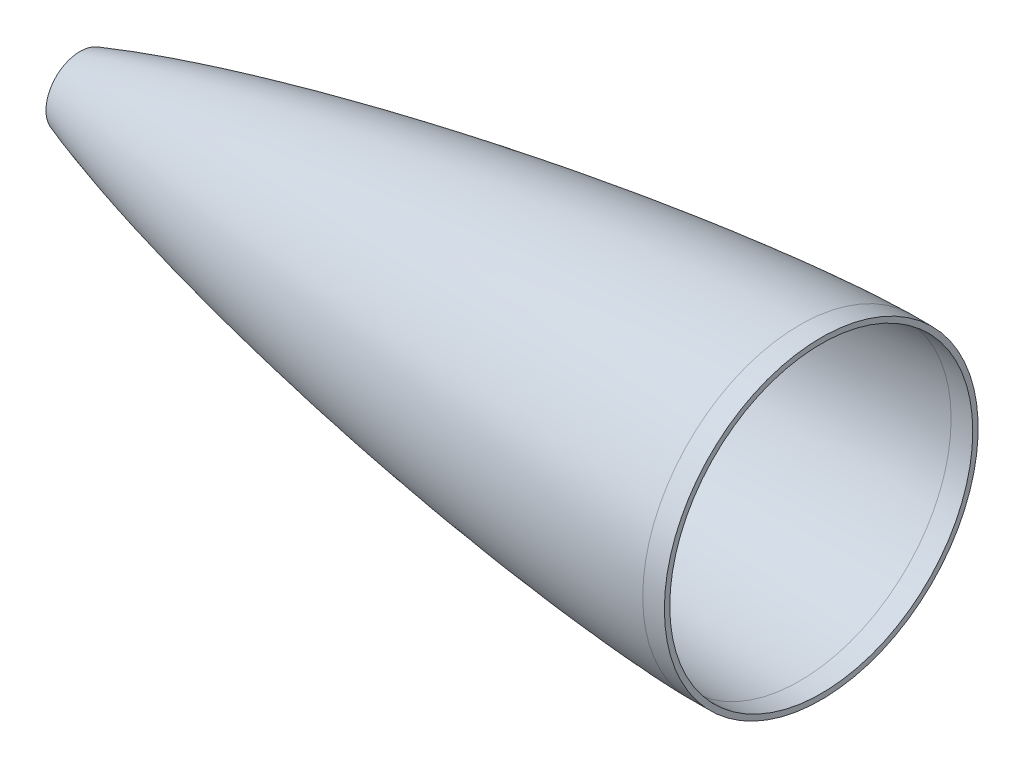
from build123d import *

# Parameters (mm, degrees)
SKETCH2_R          = 92.090147431
CUT_EXTRUDE1_DEPTH = 38.1


with BuildPart() as part:
    # Sketch1 → Revolve3 (revolve)
    with BuildSketch(Plane.XY):
        with BuildLine():
            Line((457.2, 88.915147431), (469.892984383, 88.915147431))
            Line((469.892984383, 88.915147431), (469.892984383, 92.090147431))
            Line((469.892984383, 92.090147431), (457.192984384, 92.090147431))
            add(Edge.make_bspline(
                [(-3.233508367, 0), (-3.233091917, 0.002159351), (-3.225370703, 0.042194387), (-3.210344318, 0.120106966), (-3.188435685, 0.233708596), (-3.170158628, 0.32846611), (-3.155581532, 0.404071414), (-3.14452698, 0.461323819), (-3.135702056, 0.507289694), (-3.127773696, 0.547974891), (-3.124795922, 0.564494128), (-3.117884925, 0.598113021), (-3.12389877, 0.572570576), (-3.092218192, 0.723938676), (-3.062426493, 0.844054243), (-2.999999157, 1.059492787), (-2.910399409, 1.29015919), (-2.839778822, 1.444751643), (-2.778490919, 1.568126217), (-2.703000766, 1.708426396), (-2.620342037, 1.848474413), (-2.527990504, 1.992285772), (-2.359538461, 2.236689078), (-2.142996852, 2.508992502), (-1.881793922, 2.802548024), (-1.637631123, 3.053742481), (-1.324310064, 3.355494804), (-0.948569114, 3.68869122), (-0.510284543, 4.0487848), (0.06605553, 4.494230327), (0.775419001, 5.002646378), (1.622538373, 5.567344937), (2.465899877, 6.097985733), (3.310401394, 6.604698852), (4.437098633, 7.253356973), (5.847096513, 8.023022954), (7.546412635, 8.89995712), (9.250753664, 9.738829575), (11.529428483, 10.816668257), (14.391939519, 12.101260395), (17.843607613, 13.564818771), (22.464264455, 15.434270269), (28.272278969, 17.643940291), (35.277754146, 20.145216345), (42.314927524, 22.527180792), (51.731380377, 25.568528814), (63.553210036, 29.159760164), (77.803965845, 33.207926205), (92.10542816, 37.039296827), (106.449280559, 40.685809664), (120.828931508, 44.16975032), (140.043921329, 48.619680538), (164.132147471, 53.847742447), (193.129092802, 59.655453874), (222.204595627, 65.036857396), (251.349807544, 70.015514622), (280.558943147, 74.60111456), (309.828165452, 78.791810448), (339.155497078, 82.573036224), (368.540786684, 85.913686983), (393.079021169, 88.285036363), (412.743393766, 89.879788877), (427.513154277, 90.899632435), (439.836947938, 91.569982221), (448.492805976, 91.905385522), (453.437707673, 92.04103176), (455.94391535, 92.08462741), (457.192984384, 92.090147431)],
                knots=[-0.00130248, -0.00130248, -0.00130248, -0.00130248, -0.001288447, -0.001042305, -0.000796164, -0.000550022, -0.000426952, -0.000303881, -0.00018081, -0.000119275, -5.7739e-05, -2.6972e-05, 3.796e-06, 1.918e-05, 3.4564e-05, 6.5331e-05, 0.000126867, 0.000188402, 0.000249937, 0.000311473, 0.000434543, 0.000557614, 0.000680685, 0.001172968, 0.001665251, 0.002157534, 0.002649816, 0.003634382, 0.004618948, 0.005603514, 0.007572645, 0.009541777, 0.011510909, 0.01348004, 0.015449172, 0.019387435, 0.023325698, 0.027263962, 0.031202225, 0.039078751, 0.046955278, 0.054831804, 0.070584857, 0.08633791, 0.102090962, 0.117844015, 0.149350121, 0.180856227, 0.212362332, 0.243868438, 0.275374543, 0.306880649, 0.36989286, 0.432905072, 0.495917283, 0.558929494, 0.621941706, 0.684953917, 0.747966128, 0.810978339, 0.873990551, 0.905496656, 0.937002762, 0.968508868, 0.98426192, 0.992138447, 1.000014973, 1.000014973, 1.000014973, 1.000014973], degree=3))
            Line((-3.233508367, 0), (0, 0))
            add(Edge.make_bspline(
                [(0, 0), (0.002251955, 0.011676588), (0.008171223, 0.034603408), (0.025920332, 0.078693153), (0.069506873, 0.163021891), (0.133875619, 0.263125341), (0.219057571, 0.377905451), (0.33694037, 0.520734571), (0.508236087, 0.709975777), (0.796656587, 0.996403728), (1.297265173, 1.437124084), (2.171243694, 2.115775414), (3.700404989, 3.156499891), (6.415537416, 4.768880973), (11.135640007, 7.199170252), (18.881852662, 10.660716161), (32.160919973, 15.830947346), (51.228084723, 22.245327822), (75.229131533, 29.342604036), (102.986961257, 36.663715803), (131.618382458, 43.519050039), (160.373138085, 49.83546053), (189.226352811, 55.683464578), (218.16270089, 61.10472406), (247.17126866, 66.124395917), (276.244707873, 70.75358303), (305.377643318, 74.992305893), (334.566457513, 78.828059327), (363.808737294, 82.233896116), (389.441443154, 84.794069484), (411.444894, 86.632779371), (428.633298536, 87.789416454), (439.738392817, 88.385752129), (448.426238411, 88.733777395), (453.439259359, 88.867059114), (455.94632597, 88.90960706), (457.2, 88.915147431)],
                knots=[0, 0, 0, 0, 0, 0.000101179, 0.000202358, 0.000404715, 0.000809431, 0.001115715, 0.001421998, 0.001985248, 0.002987871, 0.004583921, 0.007112659, 0.011425968, 0.018769716, 0.031526478, 0.052412239, 0.083827716, 0.14038342, 0.203214573, 0.266045748, 0.328876911, 0.391708076, 0.454539237, 0.517370407, 0.580201571, 0.643032735, 0.705863901, 0.768695068, 0.831526236, 0.894357403, 0.925772984, 0.957188566, 0.978594283, 0.989297141, 1, 1, 1, 1, 1], degree=4))
        make_face()
    revolve(axis=Axis((0, 0, 0), (1, 0, 0)))

    # Sketch2 → Cut-Extrude1 (cut)
    with BuildSketch(Plane(origin=(-3.233508372, 0, 0), x_dir=(0, 0, -1), z_dir=(1, 0, 0))):
        Circle(SKETCH2_R)
    extrude(amount=CUT_EXTRUDE1_DEPTH, mode=Mode.SUBTRACT)


solid = part.part
